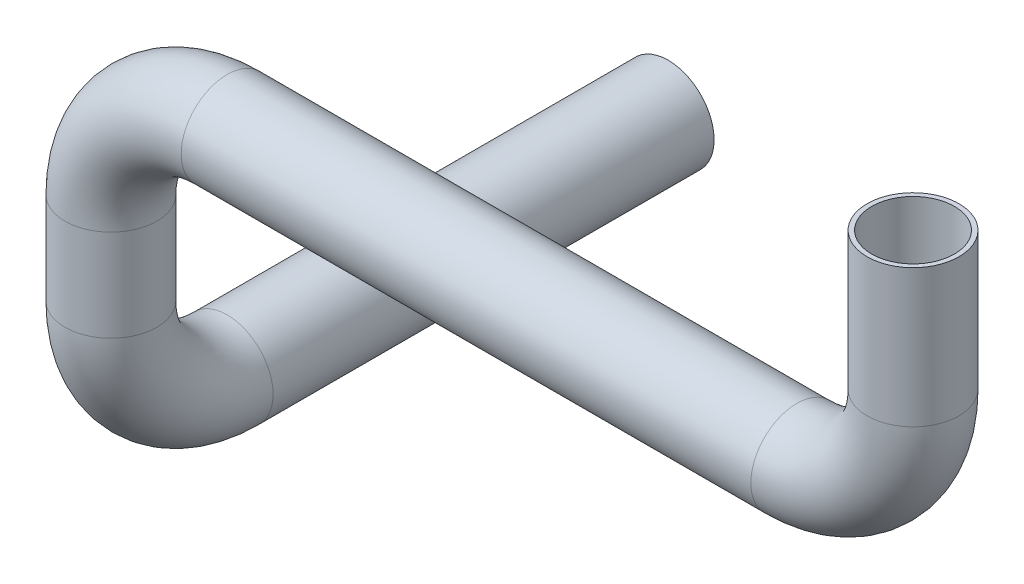
from build123d import *

# Parameters (mm, degrees)
SKETCH2_R          = 5
SWEEP2_OUTLINE_R   = 5
SWEEP2_ANGLE       = 90
SWEEP2_START       = -60.65
SWEEP2_2_OUTLINE_R = 5
SWEEP2_2_DEPTH     = 48.65
SHELL1_T           = -0.5


with BuildPart() as part:
    # Sweep1: sweep along a path in Sketch3
    with BuildLine(Plane.XY) as sweep1_path:
        Line((0, 0), (0, 10))
        ThreePointArc((0, 10), (3.705099218, 18.944900782), (12.65, 22.65))
        Line((12.65, 22.65), (74.65, 22.65))
        ThreePointArc((74.65, 22.65), (83.594900782, 26.355099218), (87.3, 35.3))
        Line((87.3, 35.3), (87.3, 50.3))
    # Sketch2 → Sweep1 (sweep)
    with BuildSketch(Plane(origin=(0, 0, 0), x_dir=(1, 0, 0), z_dir=(0, 1, 0))):
        Circle(SKETCH2_R)
    sweep(path=sweep1_path.line)

    # Sweep2: read off the stored shape, not the designer's step
    # Sweep2 outline → Sweep2 (revolve)
    with BuildSketch(Plane(origin=(0, 0, -12.65), x_dir=(0, 0, 1), z_dir=(0, 1, 0))):
        with Locations((12.65, 0)):
            Circle(SWEEP2_OUTLINE_R)
    revolve(axis=Axis((0, 0, -12.65), (1, 0, 0)), revolution_arc=SWEEP2_ANGLE)

    # Sweep2 2 outline → Sweep2 2 (add)
    with BuildSketch(Plane.XY.offset(SWEEP2_START)):
        with Locations((0, -12.65)):
            Circle(SWEEP2_2_OUTLINE_R)
    extrude(amount=SWEEP2_2_DEPTH)

    # Shell1
    shell1_openings = [part.faces().sort_by_distance(p)[0] for p in [
        (0, -12.65, -60.65),
        (87.3, 50.3, 0),
    ]]
    offset(amount=SHELL1_T, openings=shell1_openings, kind=Kind.INTERSECTION)


solid = part.part
